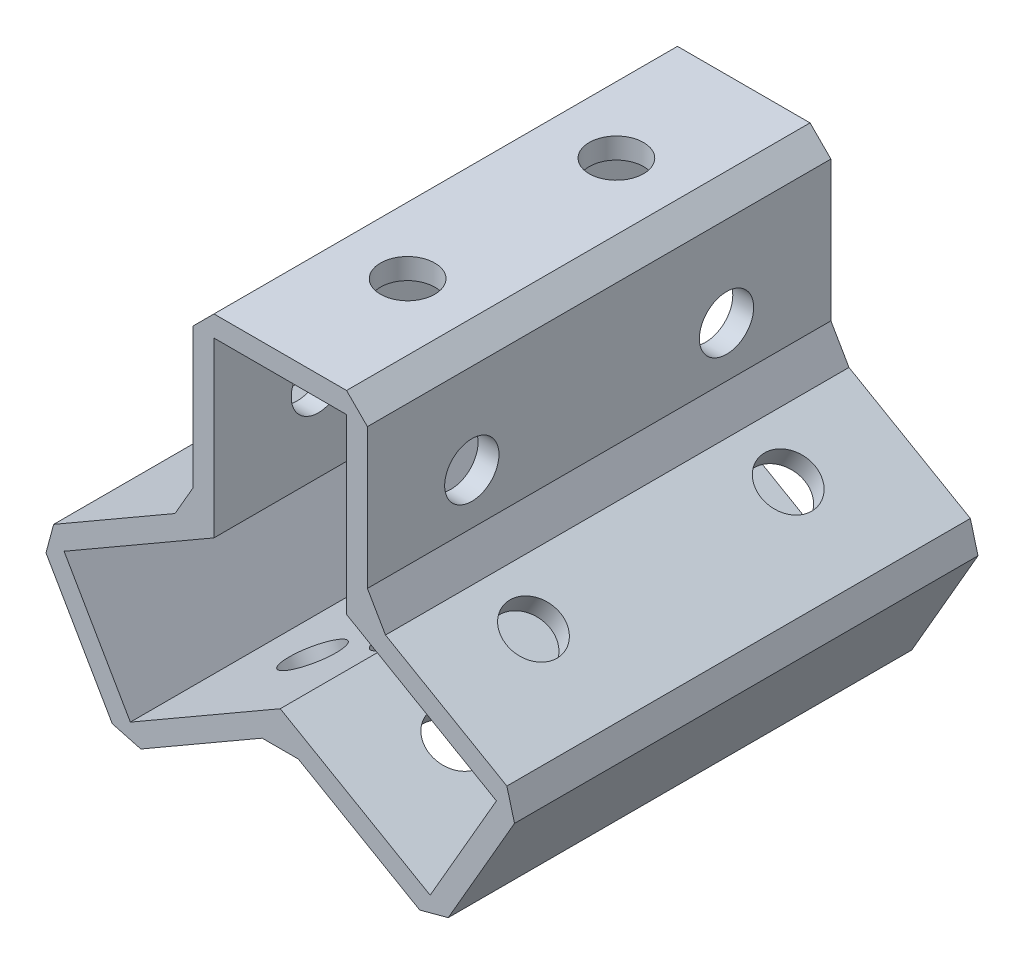
from build123d import *

# Parameters (mm, degrees)
BOSS_EXTRUDE1_DEPTH = 44.4
SKETCH4_R           = 2.6
CUT_EXTRUDE1_DEPTH  = 59.211840581
SKETCH6_R           = 2.6
CUT_EXTRUDE2_DEPTH  = 65.569616831
CHAMFER1_SIZE       = 2
SKETCH7_R           = 2.6
CUT_EXTRUDE3_DEPTH  = 59.43220581
SKETCH9_R           = 2.6
CUT_EXTRUDE4_DEPTH  = 60.570802035


with BuildPart() as part:
    # Sketch1 → Boss-Extrude1 (new body)
    with BuildSketch(Plane.XY):
        Polygon((-8.35, 22.246174209), (-8.35, 4.820874748), (-23.440752002, -3.891774983), (-15.090752002, -18.354399226), (0, -9.641749495), (15.090752002, -18.354399226), (23.440752002, -3.891774983), (8.35, 4.820874748), (8.35, 22.246174209), align=None)
        Polygon((-20.708701195, -4.623825791), (-6.35, 3.666174209), (-6.35, 20.246174209), (6.35, 20.246174209), (6.35, 3.666174209), (20.708701195, -4.623825791), (14.358701195, -15.622348419), (0, -7.332348419), (-14.358701195, -15.622348419), align=None, mode=Mode.SUBTRACT)
    extrude(amount=BOSS_EXTRUDE1_DEPTH)

    # Sketch4 → Cut-Extrude1 (cut, through all)
    with BuildSketch(Plane(origin=(-4.175, 7.231312122, 0), x_dir=(0.8660254037844606, 0.4999999999999621, 0), z_dir=(-0.4999999999999621, 0.8660254037844606, 0))):
        with Locations((-11.644441584, -10)):
            Circle(SKETCH4_R)
        with Locations((-11.644441584, -34.4)):
            Circle(SKETCH4_R)
    extrude(amount=-CUT_EXTRUDE1_DEPTH, mode=Mode.SUBTRACT)

    # Sketch6 → Cut-Extrude2 (cut, through all)
    with BuildSketch(Plane(origin=(0, 22.246174209, 0), x_dir=(1, 0, 0), z_dir=(0, 1, 0))):
        with Locations((0, -12.2)):
            Circle(SKETCH6_R)
        with Locations((0, -32.2)):
            Circle(SKETCH6_R)
    extrude(amount=-CUT_EXTRUDE2_DEPTH, mode=Mode.SUBTRACT)

    # Chamfer1
    chamfer1_edges = [part.edges().sort_by_distance(p)[0] for p in [
        (-8.35, 4.820874748, 22.2),
        (-8.35, 22.246174209, 22.2),
        (8.35, 22.246174209, 22.2),
        (8.35, 4.820874748, 22.2),
        (23.440752002, -3.891774983, 22.2),
        (0, -9.641749495, 4.8),
        (0, -9.641749495, 22.2),
        (15.090752002, -18.354399226, 22.2),
        (0, -9.641749495, 39.6),
        (-23.440752002, -3.891774983, 22.2),
        (-15.090752002, -18.354399226, 22.2),
    ]]
    chamfer(chamfer1_edges, length=CHAMFER1_SIZE)

    # Sketch7 → Cut-Extrude3 (cut, through all)
    with BuildSketch(Plane(origin=(8.35, 0, 0), x_dir=(0, 0, -1), z_dir=(1, 0, 0))):
        with Locations((-10, 11.644441584)):
            Circle(SKETCH7_R)
        with Locations((-34.4, 11.644441584)):
            Circle(SKETCH7_R)
    extrude(amount=-CUT_EXTRUDE3_DEPTH, mode=Mode.SUBTRACT)

    # Sketch9 → Cut-Extrude4 (cut, through all)
    with BuildSketch(Plane(origin=(-4.175, -7.231312122, 0), x_dir=(0.8660254037844506, -0.49999999999997924, 0), z_dir=(-0.4999999999999793, -0.8660254037844507, 0))):
        with Locations((11.644441584, 34.4)):
            Circle(SKETCH9_R)
        with Locations((11.644441584, 10)):
            Circle(SKETCH9_R)
    extrude(amount=-CUT_EXTRUDE4_DEPTH, mode=Mode.SUBTRACT)


solid = part.part
